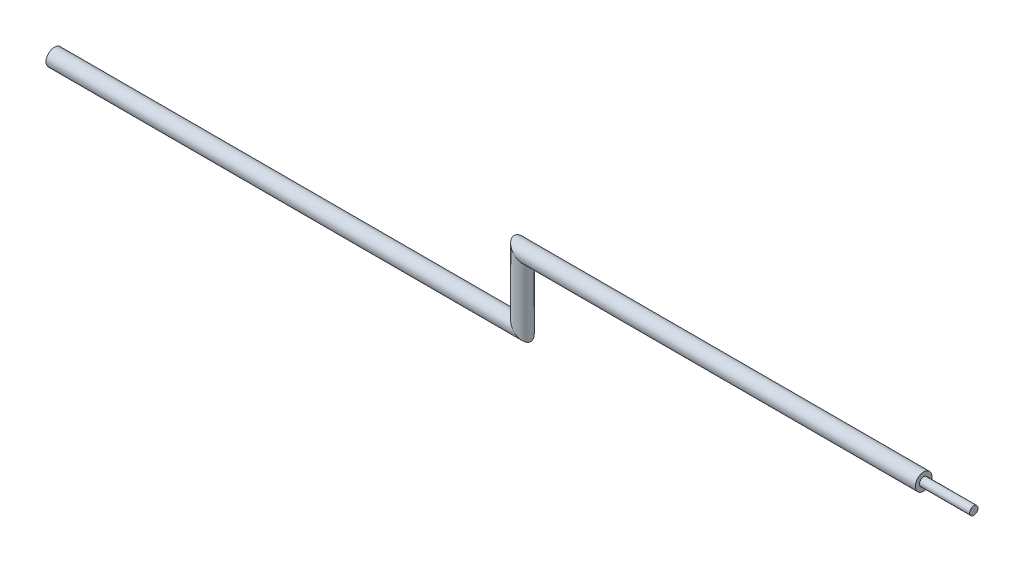
from build123d import *

# Parameters (mm, degrees)
SWEEP1_PROFILE_R    = 6.35
SKETCH20_R          = 3.175
BOSS_EXTRUDE3_DEPTH = 38.1


with BuildPart() as part:
    # Sweep1: sweep along a path in Sketch1
    with BuildLine(Plane.XY) as sweep1_path:
        Line((0, 0), (355.6, 0))
        Line((355.6, 0), (355.6, 50.8))
        Line((355.6, 50.8), (660.4, 50.8))
    # Sweep1 profile (on start of the path) → Sweep1 (sweep)
    with BuildSketch(Plane.YZ):
        Circle(SWEEP1_PROFILE_R)
    sweep(path=sweep1_path.line, transition=Transition.RIGHT)

    # Sketch20 → Boss-Extrude3 (add)
    with BuildSketch(Plane(origin=(660.4, 0, 0), x_dir=(0, 0, -1), z_dir=(1, 0, 0))):
        with Locations((0, 50.8)):
            Circle(SKETCH20_R)
    extrude(amount=BOSS_EXTRUDE3_DEPTH)


solid = part.part
